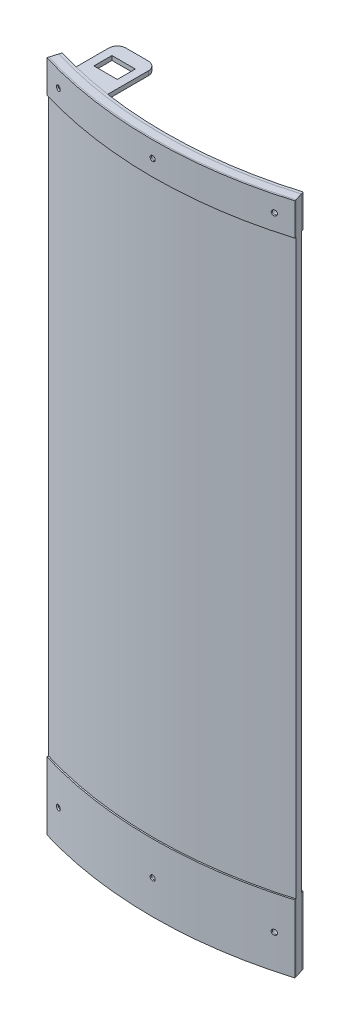
from build123d import *

# Parameters (mm, degrees)
BOSS_EXTRUDE1_DEPTH     = 398.272
BOSS_EXTRUDE2_DEPTH     = 19.05
BOSS_EXTRUDE3_DEPTH     = 19.05
BOSS_EXTRUDE4_DEPTH     = 39.878
BOSS_EXTRUDE5_DEPTH     = 39.878
CUT_EXTRUDE1_DEPTH      = 508
SKETCH7_W               = 10.643644845
SKETCH7_H               = 10.643644845
BOSS_EXTRUDE6_DEPTH     = 2.54
MOVE_START              = 397.002
MOVE_FACE1_DEPTH        = 1.27
MOVE_FACE2_BY           = 1.27
MOVE_FACE3_BY           = 1.27
MOVE_FACE4_BY           = 1.27
MOVE_FACE5_BY           = 1.27
SKETCH8_R               = 1.524
CUT_EXTRUDE3_DEPTH      = 25.4
CIRPATTERN1_COUNT       = 2
CIRPATTERN1_ANGLE       = 14.5
MIRROR1_COPY_1_SKETCH_R = 1.524
MIRROR1_COPY_1_DEPTH    = 25.4
CUT_EXTRUDE4_DEPTH      = 405.07605129
MOVE_START_2            = -17.687917762
MOVE_FACE7_OUTLINE_W    = 3.175
MOVE_FACE7_OUTLINE_H    = 2.54
MOVE_FACE7_DEPTH        = 24.201960775
MOVE_START_3            = 394.208
MOVE_FACE8_DEPTH        = 2.54
MOVE_FACE9_BY           = 3.175
MOVE_FACE10_BY          = 3.175
MOVE_FACE11_BY          = 1.5875
MOVE_FACE11_2_BY        = 1.5875
MOVE_FACE12_BY          = 1.5875
MOVE_FACE13_BY          = 1.5875
MOVE_FACE13_2_BY        = 1.5875
MOVE_START_4            = -38.336304896
MOVE_FACE14_OUTLINE_W   = 2.54
MOVE_FACE14_OUTLINE_H   = 26.033509829
MOVE_FACE14_DEPTH       = 1.5875
MOVE_START_5            = -60.092449741
MOVE_FACE14_2_OUTLINE_W = 2.54
MOVE_FACE14_2_OUTLINE_H = 21.755165201
MOVE_FACE14_2_DEPTH     = 1.5875
MOVE_FACE15_BY          = 3.175
FILLET1_R               = 5.08


with BuildPart() as part:
    # Sketch1 → Boss-Extrude1 (new body)
    with BuildSketch(Plane(origin=(0, 0, 0), x_dir=(1, 0, 0), z_dir=(0, 1, 0))):
        with BuildLine():
            Line((-73.66, 0), (-75.070390605, -4.548868496))
            ThreePointArc((-75.070390605, -4.548868496), (0, -15.919761365), (75.070390605, -4.548868496))
            Line((75.070390605, -4.548868496), (73.66, 0))
            ThreePointArc((73.66, 0), (0, -11.157261365), (-73.66, 0))
        make_face()
    extrude(amount=BOSS_EXTRUDE1_DEPTH)


with BuildPart() as body_2:
    # Sketch2 → Boss-Extrude2 (new body)
    with BuildSketch(Plane(origin=(0, 398.272, 0), x_dir=(1, 0, 0), z_dir=(0, 1, 0))):
        with BuildLine():
            Line((-75.070390605, -4.548868496), (-75.333663518, -5.397990615))
            ThreePointArc((-75.333663518, -5.397990615), (0, -16.808761365), (75.333663518, -5.397990615))
            Line((75.333663518, -5.397990615), (75.070390605, -4.548868496))
            ThreePointArc((75.070390605, -4.548868496), (0, -15.919761365), (-75.070390605, -4.548868496))
        make_face()
    extrude(amount=-BOSS_EXTRUDE2_DEPTH)


with BuildPart() as body_3:
    # Sketch3 → Boss-Extrude3 (new body)
    with BuildSketch(Plane(origin=(0, 398.272, 0), x_dir=(1, 0, 0), z_dir=(0, 1, 0))):
        with BuildLine():
            Line((-73.17106459, 1.576941079), (-73.66, 0))
            ThreePointArc((-73.66, 0), (0, -11.157261365), (73.66, 0))
            Line((73.66, 0), (73.17106459, 1.576941079))
            ThreePointArc((73.17106459, 1.576941079), (0, -9.506261365), (-73.17106459, 1.576941079))
        make_face()
    extrude(amount=-BOSS_EXTRUDE3_DEPTH)


with BuildPart() as body_4:
    # Sketch4 → Boss-Extrude4 (new body)
    with BuildSketch(Plane.XZ):
        with BuildLine():
            Line((75.070390605, 4.548868496), (75.333663518, 5.397990615))
            ThreePointArc((75.333663518, 5.397990615), (0, 16.808761365), (-75.333663518, 5.397990615))
            Line((-75.333663518, 5.397990615), (-75.070390605, 4.548868496))
            ThreePointArc((-75.070390605, 4.548868496), (0, 15.919761365), (75.070390605, 4.548868496))
        make_face()
    extrude(amount=-BOSS_EXTRUDE4_DEPTH)


with BuildPart() as body_5:
    # Sketch5 → Boss-Extrude5 (new body)
    with BuildSketch(Plane.XZ):
        with BuildLine():
            Line((-73.66, 0), (-73.17106459, -1.576941079))
            ThreePointArc((-73.17106459, -1.576941079), (0, 9.506261365), (73.17106459, -1.576941079))
            Line((73.17106459, -1.576941079), (73.66, 0))
            ThreePointArc((73.66, 0), (0, 11.157261365), (-73.66, 0))
        make_face()
    extrude(amount=-BOSS_EXTRUDE5_DEPTH)


with BuildPart() as cut_extrude1_tool:
    # Sketch6 → Cut-Extrude1 (new body)
    with BuildSketch(Plane(origin=(0, 0, 0), x_dir=(1, 0, 0), z_dir=(0, 1, 0))):
        Polygon((73.17106459, 1.576941079), (73.17106459, -8.359096802), (86.604464861, -0.591303231), align=None)
        Polygon((-73.17106459, 1.576941079), (-73.17106459, -8.359096802), (-85.415039494, 1.576941079), align=None)
    extrude(amount=CUT_EXTRUDE1_DEPTH)


with BuildPart() as part_1:
    add(part.part)

    # Cut-Extrude1: cut by cut_extrude1_tool
    add(cut_extrude1_tool.part, mode=Mode.SUBTRACT)

    # Move Face2: a face moved inward by 1.27
    extrude(part_1.faces().sort_by_distance((0, 398.272, 11.977582218))[0], amount=MOVE_FACE2_BY, dir=(0, -1, 0), mode=Mode.SUBTRACT)


with BuildPart() as body_2_1:
    add(body_2.part)

    # Cut-Extrude1: cut by cut_extrude1_tool
    add(cut_extrude1_tool.part, mode=Mode.SUBTRACT)

    # Move Face1: read off the stored shape, not the designer's step
    # Move Face1 outline → Move Face1 (cut)
    with BuildSketch(Plane(origin=(0, 0, 0), x_dir=(1, 0, 0), z_dir=(0, 1, 0)).offset(MOVE_START)):
        with BuildLine():
            ThreePointArc((73.17106459, -5.129614202), (0, -15.919761365), (-73.17106459, -5.129614202))
            Line((-73.17106459, -5.129614202), (-73.17106459, -6.057990334))
            ThreePointArc((-73.17106459, -6.057990334), (0, -16.808761365), (73.17106459, -6.057990334))
            Line((73.17106459, -6.057990334), (73.17106459, -5.129614202))
        make_face()
    extrude(amount=MOVE_FACE1_DEPTH, mode=Mode.SUBTRACT)

    # Move Face5: a face moved outward by 1.27
    extrude(body_2_1.faces().sort_by_distance((-36.585532295, 379.222, 13.888974574))[0], amount=MOVE_FACE5_BY, dir=(0, -1, 0))


with BuildPart() as body_3_1:
    add(body_3.part)

    # Cut-Extrude1: cut by cut_extrude1_tool
    add(cut_extrude1_tool.part, mode=Mode.SUBTRACT)

    # Sketch7 → Boss-Extrude6 (add)
    with BuildSketch(Plane(origin=(0, 396.748, 0), x_dir=(1, 0, 0), z_dir=(0, 1, 0))):
        with BuildLine():
            Line((-61.679949741, -1.683626417), (-61.679949741, 17.687917762))
            Line((-61.679949741, 17.687917762), (-41.511304896, 17.687917762))
            Line((-41.511304896, 17.687917762), (-41.511304896, -5.994172694))
            ThreePointArc((-41.511304896, -5.994172694), (-51.640623164, -4.049430926), (-61.679949741, -1.683626417))
        make_face()
        with Locations((-51.595627319, 7.603595339)):
            Rectangle(SKETCH7_W, SKETCH7_H, mode=Mode.SUBTRACT)
    extrude(amount=-BOSS_EXTRUDE6_DEPTH)

    # Move Face3: a face moved inward by 1.27
    extrude(body_3_1.faces().sort_by_distance((0, 398.272, 9.88384112))[0], amount=MOVE_FACE3_BY, dir=(0, -1, 0), mode=Mode.SUBTRACT)

    # Move Face4: a face moved outward by 1.27
    extrude(body_3_1.faces().sort_by_distance((0, 379.222, 9.88384112))[0], amount=MOVE_FACE4_BY, dir=(0, -1, 0))


with BuildPart() as body_4_1:
    add(body_4.part)

    # Cut-Extrude1: cut by cut_extrude1_tool
    add(cut_extrude1_tool.part, mode=Mode.SUBTRACT)


with BuildPart() as body_5_1:
    add(body_5.part)

    # Cut-Extrude1: cut by cut_extrude1_tool
    add(cut_extrude1_tool.part, mode=Mode.SUBTRACT)


with BuildPart() as cut_extrude3_tool:
    # Sketch8 → Cut-Extrude3 (new, symmetric)
    with BuildSketch(Plane.XY):
        with Locations((0, 19.939)):
            Circle(SKETCH8_R)
        with Locations((0, 387.477)):
            Circle(SKETCH8_R)
    cut_extrude3 = extrude(amount=CUT_EXTRUDE3_DEPTH, both=True)


with BuildPart() as part_2:
    add(part_1.part)

    # Cut-Extrude3: cut by cut_extrude3_tool
    add(cut_extrude3_tool.part, mode=Mode.SUBTRACT)


with BuildPart() as body_2_2:
    add(body_2_1.part)

    # Cut-Extrude3: cut by cut_extrude3_tool
    add(cut_extrude3_tool.part, mode=Mode.SUBTRACT)


with BuildPart() as body_3_2:
    add(body_3_1.part)

    # Cut-Extrude3: cut by cut_extrude3_tool
    add(cut_extrude3_tool.part, mode=Mode.SUBTRACT)


with BuildPart() as body_4_2:
    add(body_4_1.part)

    # Cut-Extrude3: cut by cut_extrude3_tool
    add(cut_extrude3_tool.part, mode=Mode.SUBTRACT)


with BuildPart() as body_5_2:
    add(body_5_1.part)

    # Cut-Extrude3: cut by cut_extrude3_tool
    add(cut_extrude3_tool.part, mode=Mode.SUBTRACT)


with BuildPart() as cirpattern1_tool:
    # CirPattern1: Cut-Extrude3 ×2 about axis
    cirpattern1_axis = Axis((0, 398.272, -237.572238635), (0, -1, 0))
    for i in range(1, CIRPATTERN1_COUNT):
        add(cut_extrude3.rotate(cirpattern1_axis, i * CIRPATTERN1_ANGLE / (CIRPATTERN1_COUNT - 1)))


with BuildPart() as part_3:
    add(part_2.part)

    # CirPattern1: cut by cirpattern1_tool
    add(cirpattern1_tool.part, mode=Mode.SUBTRACT)


with BuildPart() as body_2_3:
    add(body_2_2.part)

    # CirPattern1: cut by cirpattern1_tool
    add(cirpattern1_tool.part, mode=Mode.SUBTRACT)


with BuildPart() as body_3_3:
    add(body_3_2.part)

    # CirPattern1: cut by cirpattern1_tool
    add(cirpattern1_tool.part, mode=Mode.SUBTRACT)


with BuildPart() as body_4_3:
    add(body_4_2.part)

    # CirPattern1: cut by cirpattern1_tool
    add(cirpattern1_tool.part, mode=Mode.SUBTRACT)


with BuildPart() as body_5_3:
    add(body_5_2.part)

    # CirPattern1: cut by cirpattern1_tool
    add(cirpattern1_tool.part, mode=Mode.SUBTRACT)


with BuildPart() as mirror1_copy_1_tool:
    # Mirror1 copy 1 sketch → Mirror1 copy 1 (new, symmetric)
    with BuildSketch(Plane(origin=(59.483338073, 0, -7.567236381), x_dir=(-0.9681476403781076, 0, 0.25038000405444194), z_dir=(0.25038000405444194, 0, 0.9681476403781076))):
        with Locations((0, -19.939)):
            Circle(MIRROR1_COPY_1_SKETCH_R)
        with Locations((0, -387.477)):
            Circle(MIRROR1_COPY_1_SKETCH_R)
    extrude(amount=MIRROR1_COPY_1_DEPTH, both=True)


with BuildPart() as part_4:
    add(part_3.part)

    # Mirror1 copy 1: cut by mirror1_copy_1_tool
    add(mirror1_copy_1_tool.part, mode=Mode.SUBTRACT)

    # Move Face6: read off the stored shape, not the designer's step
    # Move Face6: loft between two sections, ruled curve by curve
    move_face6_from = [
        Edge.make_three_point_arc((-2.147043195, 387.703906411, 11.147888716), (-0.226906411, 385.329956805, 11.147888716), (2.147043195, 387.250093589, 11.147888716)),
        Edge.make_three_point_arc((2.147043195, 387.250093589, 11.147888716), (0.226906411, 389.624043195, 11.147888716), (-2.147043195, 387.703906411, 11.147888716)),
    ]
    move_face6_to = [
        Edge.make_three_point_arc((-2.147043195, 387.703906411, 15.919766393), (-0.226906411, 385.329956805, 15.919766393), (2.147043195, 387.250093589, 15.919766393)),
        Edge.make_three_point_arc((2.147043195, 387.250093589, 15.919766393), (0.226906411, 389.624043195, 15.919766393), (-2.147043195, 387.703906411, 15.919766393)),
    ]
    move_face6 = Solid(Shell([*[Face.make_surface_from_curves(move_face6_from[k], move_face6_to[k]) for k in range(2)], Face(Wire(move_face6_from)), Face(Wire(move_face6_to))]))
    add(move_face6, mode=Mode.SUBTRACT)

    # Move Face6 2: loft between two sections, ruled curve by curve
    move_face6_2_from = [
        Edge.make_three_point_arc((-2.147043195, 20.165906411, 11.147888716), (-0.226906411, 17.791956805, 11.147888716), (2.147043195, 19.712093589, 11.147888716)),
        Edge.make_three_point_arc((2.147043195, 19.712093589, 11.147888716), (0.226906411, 22.086043195, 11.147888716), (-2.147043195, 20.165906411, 11.147888716)),
    ]
    move_face6_2_to = [
        Edge.make_three_point_arc((-2.147043195, 20.165906411, 15.919766393), (-0.226906411, 17.791956805, 15.919766393), (2.147043195, 19.712093589, 15.919766393)),
        Edge.make_three_point_arc((2.147043195, 19.712093589, 15.919766393), (0.226906411, 22.086043195, 15.919766393), (-2.147043195, 20.165906411, 15.919766393)),
    ]
    move_face6_2 = Solid(Shell([*[Face.make_surface_from_curves(move_face6_2_from[k], move_face6_2_to[k]) for k in range(2)], Face(Wire(move_face6_2_from)), Face(Wire(move_face6_2_to))]))
    add(move_face6_2, mode=Mode.SUBTRACT)

    # Move Face6 3: loft between two sections, ruled curve by curve
    move_face6_3_from = [
        Edge.make_three_point_arc((-64.353201298, 20.165906411, 2.68798909), (-62.494225401, 17.791956805, 3.168752946), (-60.195891692, 19.712093589, 3.763142458)),
        Edge.make_three_point_arc((-60.195891692, 19.712093589, 3.763142458), (-62.054867588, 22.086043195, 3.282378602), (-64.353201298, 20.165906411, 2.68798909)),
    ]
    move_face6_3_to = [
        Edge.make_three_point_arc((-65.54798405, 20.165906411, 7.307871204), (-63.689008153, 17.791956805, 7.788635059), (-61.390674444, 19.712093589, 8.383024571)),
        Edge.make_three_point_arc((-61.390674444, 19.712093589, 8.383024571), (-63.24965034, 22.086043195, 7.902260716), (-65.54798405, 20.165906411, 7.307871204)),
    ]
    move_face6_3 = Solid(Shell([*[Face.make_surface_from_curves(move_face6_3_from[k], move_face6_3_to[k]) for k in range(2)], Face(Wire(move_face6_3_from)), Face(Wire(move_face6_3_to))]))
    add(move_face6_3, mode=Mode.SUBTRACT)

    # Move Face6 4: loft between two sections, ruled curve by curve
    move_face6_4_from = [
        Edge.make_three_point_arc((-64.353201298, 387.703906411, 2.68798909), (-62.494225401, 385.329956805, 3.168752946), (-60.195891692, 387.250093589, 3.763142458)),
        Edge.make_three_point_arc((-60.195891692, 387.250093589, 3.763142458), (-62.054867588, 389.624043195, 3.282378602), (-64.353201298, 387.703906411, 2.68798909)),
    ]
    move_face6_4_to = [
        Edge.make_three_point_arc((-65.54798405, 387.703906411, 7.307871204), (-63.689008153, 385.329956805, 7.788635059), (-61.390674444, 387.250093589, 8.383024571)),
        Edge.make_three_point_arc((-61.390674444, 387.250093589, 8.383024571), (-63.24965034, 389.624043195, 7.902260716), (-65.54798405, 387.703906411, 7.307871204)),
    ]
    move_face6_4 = Solid(Shell([*[Face.make_surface_from_curves(move_face6_4_from[k], move_face6_4_to[k]) for k in range(2)], Face(Wire(move_face6_4_from)), Face(Wire(move_face6_4_to))]))
    add(move_face6_4, mode=Mode.SUBTRACT)

    # Move Face6 5: loft between two sections, ruled curve by curve
    move_face6_5_from = [
        Edge.make_three_point_arc((64.353201298, 387.703906411, 2.68798909), (62.054867588, 389.624043195, 3.282378602), (60.195891692, 387.250093589, 3.763142458)),
        Edge.make_three_point_arc((60.195891692, 387.250093589, 3.763142458), (62.494225401, 385.329956805, 3.168752946), (64.353201298, 387.703906411, 2.68798909)),
    ]
    move_face6_5_to = [
        Edge.make_three_point_arc((65.54798405, 387.703906411, 7.307871204), (63.24965034, 389.624043195, 7.902260716), (61.390674444, 387.250093589, 8.383024571)),
        Edge.make_three_point_arc((61.390674444, 387.250093589, 8.383024571), (63.689008153, 385.329956805, 7.788635059), (65.54798405, 387.703906411, 7.307871204)),
    ]
    move_face6_5 = Solid(Shell([*[Face.make_surface_from_curves(move_face6_5_from[k], move_face6_5_to[k]) for k in range(2)], Face(Wire(move_face6_5_from)), Face(Wire(move_face6_5_to))]))
    add(move_face6_5, mode=Mode.SUBTRACT)

    # Move Face6 6: loft between two sections, ruled curve by curve
    move_face6_6_from = [
        Edge.make_three_point_arc((64.353201298, 20.165906411, 2.68798909), (62.054867588, 22.086043195, 3.282378602), (60.195891692, 19.712093589, 3.763142458)),
        Edge.make_three_point_arc((60.195891692, 19.712093589, 3.763142458), (62.494225401, 17.791956805, 3.168752946), (64.353201298, 20.165906411, 2.68798909)),
    ]
    move_face6_6_to = [
        Edge.make_three_point_arc((65.54798405, 20.165906411, 7.307871204), (63.24965034, 22.086043195, 7.902260716), (61.390674444, 19.712093589, 8.383024571)),
        Edge.make_three_point_arc((61.390674444, 19.712093589, 8.383024571), (63.689008153, 17.791956805, 7.788635059), (65.54798405, 20.165906411, 7.307871204)),
    ]
    move_face6_6 = Solid(Shell([*[Face.make_surface_from_curves(move_face6_6_from[k], move_face6_6_to[k]) for k in range(2)], Face(Wire(move_face6_6_from)), Face(Wire(move_face6_6_to))]))
    add(move_face6_6, mode=Mode.SUBTRACT)


with BuildPart() as body_2_4:
    add(body_2_3.part)

    # Mirror1 copy 1: cut by mirror1_copy_1_tool
    add(mirror1_copy_1_tool.part, mode=Mode.SUBTRACT)


with BuildPart() as body_3_4:
    add(body_3_3.part)

    # Mirror1 copy 1: cut by mirror1_copy_1_tool
    add(mirror1_copy_1_tool.part, mode=Mode.SUBTRACT)


with BuildPart() as body_4_4:
    add(body_4_3.part)

    # Mirror1 copy 1: cut by mirror1_copy_1_tool
    add(mirror1_copy_1_tool.part, mode=Mode.SUBTRACT)


with BuildPart() as body_5_4:
    add(body_5_3.part)

    # Mirror1 copy 1: cut by mirror1_copy_1_tool
    add(mirror1_copy_1_tool.part, mode=Mode.SUBTRACT)


with BuildPart() as cut_extrude4_tool:
    # Sketch9 → Cut-Extrude4 (new, through all)
    with BuildSketch(Plane(origin=(0, 397.002, 0), x_dir=(1, 0, 0), z_dir=(0, 1, 0))):
        Polygon((73.17106459, -6.057990334), (54.219543825, 57.042954955), (107.459896798, 57.042954955), align=None)
        Polygon((-54.219543825, 57.042954955), (-73.17106459, -6.057990334), (-111.074106121, -6.057990334), (-92.122585356, 57.042954955), align=None)
    extrude(amount=-CUT_EXTRUDE4_DEPTH)


with BuildPart() as part_5:
    add(part_4.part)

    # Cut-Extrude4: cut by cut_extrude4_tool
    add(cut_extrude4_tool.part, mode=Mode.SUBTRACT)


with BuildPart() as body_2_5:
    add(body_2_4.part)

    # Cut-Extrude4: cut by cut_extrude4_tool
    add(cut_extrude4_tool.part, mode=Mode.SUBTRACT)


with BuildPart() as body_3_5:
    add(body_3_4.part)

    # Cut-Extrude4: cut by cut_extrude4_tool
    add(cut_extrude4_tool.part, mode=Mode.SUBTRACT)

    # Move Face7: read off the stored shape, not the designer's step
    # Move Face7 outline → Move Face7 (add)
    with BuildSketch(Plane.XY.offset(MOVE_START_2)):
        with Locations((-39.923804896, 395.478)):
            Rectangle(MOVE_FACE7_OUTLINE_W, MOVE_FACE7_OUTLINE_H)
    extrude(amount=MOVE_FACE7_DEPTH)

    # Move Face8: read off the stored shape, not the designer's step
    # Move Face8 outline → Move Face8 (cut)
    with BuildSketch(Plane(origin=(0, 0, 0), x_dir=(1, 0, 0), z_dir=(0, 1, 0)).offset(MOVE_START_3)):
        with BuildLine():
            Line((-58.504949741, -2.479747439), (-58.504949741, 17.687917762))
            Line((-58.504949741, 17.687917762), (-61.679949741, 17.687917762))
            Line((-61.679949741, 17.687917762), (-61.679949741, -1.683626418))
            ThreePointArc((-61.679949741, -1.683626418), (-60.09376813, -2.086944778), (-58.504949741, -2.479747439))
        make_face()
    extrude(amount=MOVE_FACE8_DEPTH, mode=Mode.SUBTRACT)

    # Move Face9: a face moved outward by 3.175
    extrude(body_3_5.faces().sort_by_distance((-56.917449741, 395.478, -7.603595339))[0], amount=MOVE_FACE9_BY, dir=(1, 0, 0))

    # Move Face10: a face moved inward by 3.175
    extrude(body_3_5.faces().sort_by_distance((-46.273804896, 395.478, -7.603595339))[0], amount=MOVE_FACE10_BY, dir=(1, 0, 0), mode=Mode.SUBTRACT)

    # Move Face11: a face moved outward by 1.5875
    extrude(body_3_5.faces().sort_by_distance((-48.420627318, 395.478, -17.687917762))[0], amount=MOVE_FACE11_BY, dir=(0, 0, -1))

    # Move Face11 2: a face moved outward by 1.5875
    extrude(body_3_5.faces().sort_by_distance((-48.420627319, 395.478, -2.281772917))[0], amount=MOVE_FACE11_2_BY, dir=(0, 0, -1))

    # Move Face12: a face moved inward by 1.5875
    extrude(body_3_5.faces().sort_by_distance((-48.420627319, 395.478, -12.925417762))[0], amount=MOVE_FACE12_BY, dir=(0, 0, -1), mode=Mode.SUBTRACT)

    # Move Face13: a face moved inward by 1.5875
    extrude(body_3_5.faces().sort_by_distance((-43.098804896, 395.478, -9.191095339))[0], amount=MOVE_FACE13_BY, dir=(1, 0, 0), mode=Mode.SUBTRACT)

    # Move Face13 2: a face moved inward by 1.5875
    extrude(body_3_5.faces().sort_by_distance((-53.742449741, 395.478, -9.191095339))[0], amount=MOVE_FACE13_2_BY, dir=(-1, 0, 0), mode=Mode.SUBTRACT)

    # Move Face14: read off the stored shape, not the designer's step
    # Move Face14 outline → Move Face14 (add)
    with BuildSketch(Plane.YZ.offset(MOVE_START_4)):
        with Locations((395.478, -6.258662848)):
            Rectangle(MOVE_FACE14_OUTLINE_W, MOVE_FACE14_OUTLINE_H)
    extrude(amount=MOVE_FACE14_DEPTH)

    # Move Face14 2 outline → Move Face14 2 (add)
    with BuildSketch(Plane.YZ.offset(MOVE_START_5)):
        with Locations((395.478, -8.397835161)):
            Rectangle(MOVE_FACE14_2_OUTLINE_W, MOVE_FACE14_2_OUTLINE_H)
    extrude(amount=MOVE_FACE14_2_DEPTH)

    # Move Face15: a face moved outward by 3.175
    extrude(body_3_5.faces().sort_by_distance((-48.420627319, 395.478, -19.275417762))[0], amount=MOVE_FACE15_BY, dir=(0, 0, -1))

    # Fillet1
    fillet1_edges = [body_3_5.edges().sort_by_distance(p)[0] for p in [
        (-60.092449741, 395.478, -22.450417762),
        (-36.748804896, 395.478, -22.450417762),
    ]]
    fillet(fillet1_edges, radius=FILLET1_R)


with BuildPart() as body_4_5:
    add(body_4_4.part)

    # Cut-Extrude4: cut by cut_extrude4_tool
    add(cut_extrude4_tool.part, mode=Mode.SUBTRACT)


with BuildPart() as body_5_5:
    add(body_5_4.part)

    # Cut-Extrude4: cut by cut_extrude4_tool
    add(cut_extrude4_tool.part, mode=Mode.SUBTRACT)


solid = Compound([part_5.part, body_2_5.part, body_3_5.part, body_4_5.part, body_5_5.part])
